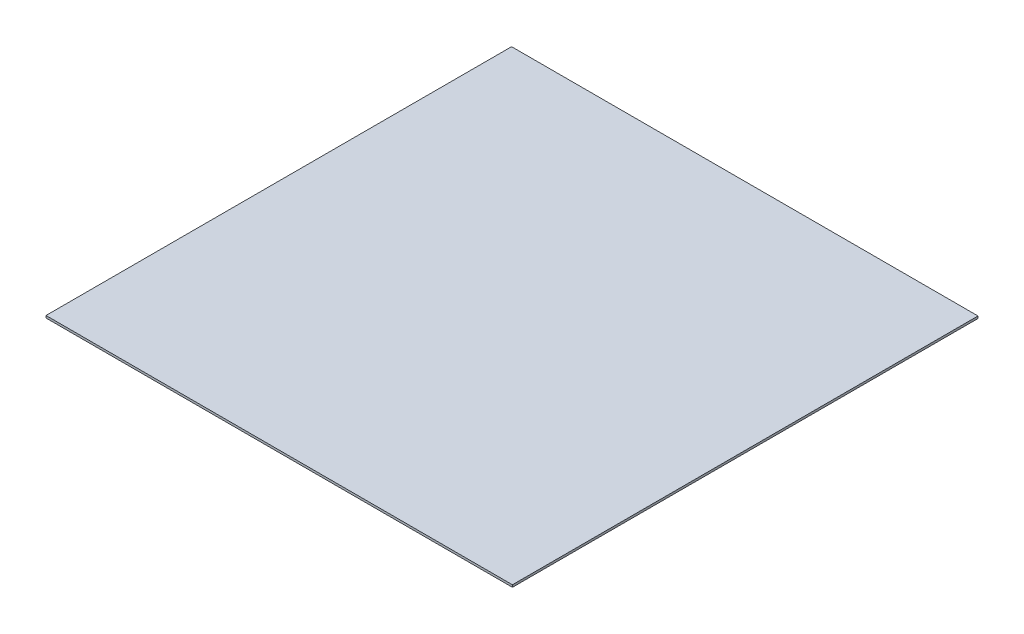
from build123d import *

# Parameters (mm, degrees)
SKETCH1_W           = 508
SKETCH1_H           = 508
BOSS_EXTRUDE1_DEPTH = 3
SKETCH5_W           = 60.275
SKETCH5_H           = 508
SKETCH5_W_2         = 508
BOSS_EXTRUDE2_DEPTH = 3


with BuildPart() as part:
    # Sketch1 → Boss-Extrude1 (new body)
    with BuildSketch(Plane(origin=(0, 0, 0), x_dir=(1, 0, 0), z_dir=(0, 1, 0))):
        Rectangle(SKETCH1_W, SKETCH1_H)
    extrude(amount=BOSS_EXTRUDE1_DEPTH)

    # Sketch5 → Boss-Extrude2 (add)
    with BuildSketch(Plane(origin=(0, 3, 0), x_dir=(1, 0, 0), z_dir=(0, 1, 0))):
        Polygon((-314.275, 313.705), (-314.275, 254), (-254, 254), (254, 254), (314.275, 254), (314.275, 313.705), align=None)
        with Locations((-284.1375, 0)):
            Rectangle(SKETCH5_W, SKETCH5_H)
        Rectangle(SKETCH5_W_2, SKETCH5_H)
        Polygon((-254, -254), (-314.275, -254), (-314.275, -313.705), (314.275, -313.705), (314.275, -254), (254, -254), align=None)
        with Locations((284.1375, 0)):
            Rectangle(SKETCH5_W, SKETCH5_H)
    extrude(amount=-BOSS_EXTRUDE2_DEPTH)


solid = part.part
